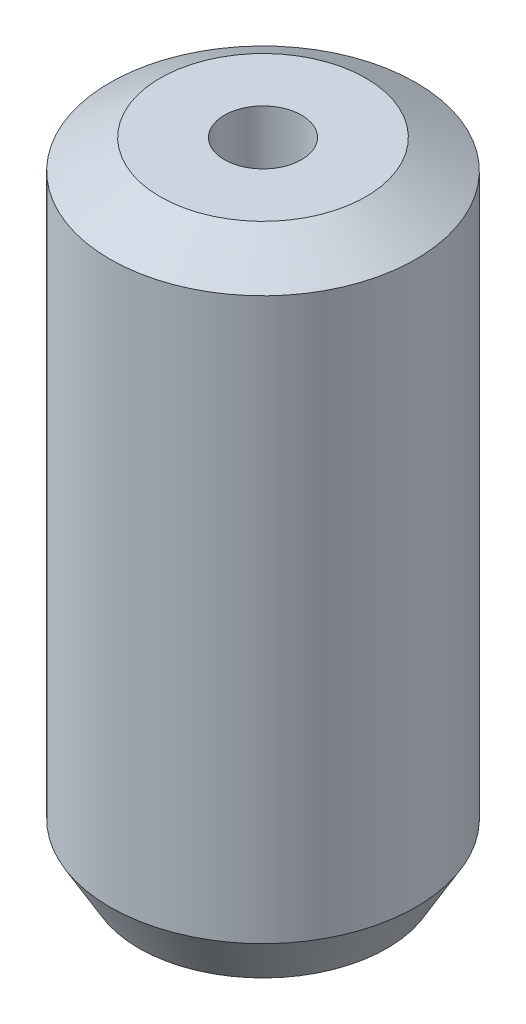
from build123d import *
from OCP.BRepFilletAPI import BRepFilletAPI_MakeChamfer

# Parameters (mm, degrees)
SKETCH1_R           = 10
BOSS_EXTRUDE1_DEPTH = 41.84609965
SKETCH2_R           = 2.523073105
CUT_EXTRUDE1_DEPTH  = 45.171212977
CHAMFER1_SIZE       = 1.894070909
CHAMFER1_SIZE2      = 3.280627048


with BuildPart() as part:
    # Sketch1 → Boss-Extrude1 (new body)
    with BuildSketch(Plane(origin=(0, 0, 0), x_dir=(1, 0, 0), z_dir=(0, 1, 0))):
        Circle(SKETCH1_R)
    extrude(amount=BOSS_EXTRUDE1_DEPTH)

    # Sketch2 → Cut-Extrude1 (cut, through all)
    with BuildSketch(Plane(origin=(0, 0, 0), x_dir=(1, 0, 0), z_dir=(0, 1, 0))):
        Circle(SKETCH2_R)
    extrude(amount=CUT_EXTRUDE1_DEPTH, mode=Mode.SUBTRACT)

    # Chamfer1: one chamfer whose edges measure the first distance from different faces: ONE call of the kernel's chamfer builder (chamfer() names one face for all edges)
    chamfer1_edges_1 = [part.edges().sort_by_distance(p)[0] for p in [
        (-10, 41.84609965, 0),
    ]]
    chamfer1_side_1 = [part.faces().sort_by_distance(p)[0] for p in [
        (-10, 20.923049825, 0),
    ]]
    chamfer1_edges_2 = [part.edges().sort_by_distance(p)[0] for p in [
        (-10, 0, 0),
    ]]
    chamfer1_side_2 = [part.faces().sort_by_distance(p)[0] for p in [
        (-9.717157288, 0, 0),
    ]]
    chamfer1 = BRepFilletAPI_MakeChamfer(part.part.solid().wrapped)
    for e in chamfer1_edges_1:
        chamfer1.Add(CHAMFER1_SIZE, CHAMFER1_SIZE2, e.wrapped, chamfer1_side_1[0].wrapped)  # the first distance lies on this face
    for e in chamfer1_edges_2:
        chamfer1.Add(CHAMFER1_SIZE, CHAMFER1_SIZE2, e.wrapped, chamfer1_side_2[0].wrapped)  # the first distance lies on this face
    add(Compound.cast(chamfer1.Shape()), mode=Mode.REPLACE)


solid = part.part
